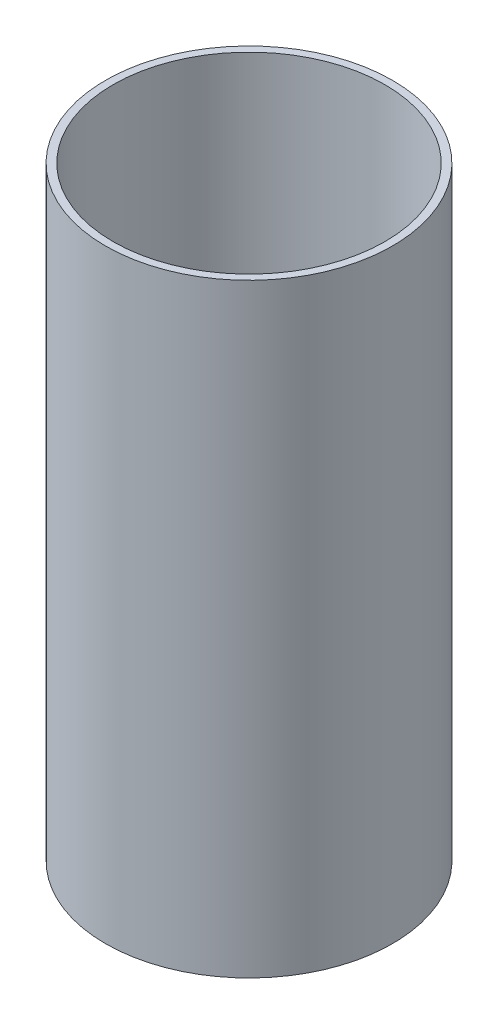
from build123d import *

# Parameters (mm, degrees)
SKETCH2_R           = 38
SKETCH2_R_2         = 36
BOSS_EXTRUDE1_DEPTH = 160


with BuildPart() as part:
    # Sketch2 → Boss-Extrude1 (new body)
    with BuildSketch(Plane(origin=(0, 0, 0), x_dir=(1, 0, 0), z_dir=(0, 1, 0))):
        Circle(SKETCH2_R)
        Circle(SKETCH2_R_2, mode=Mode.SUBTRACT)
    extrude(amount=BOSS_EXTRUDE1_DEPTH)


solid = part.part
